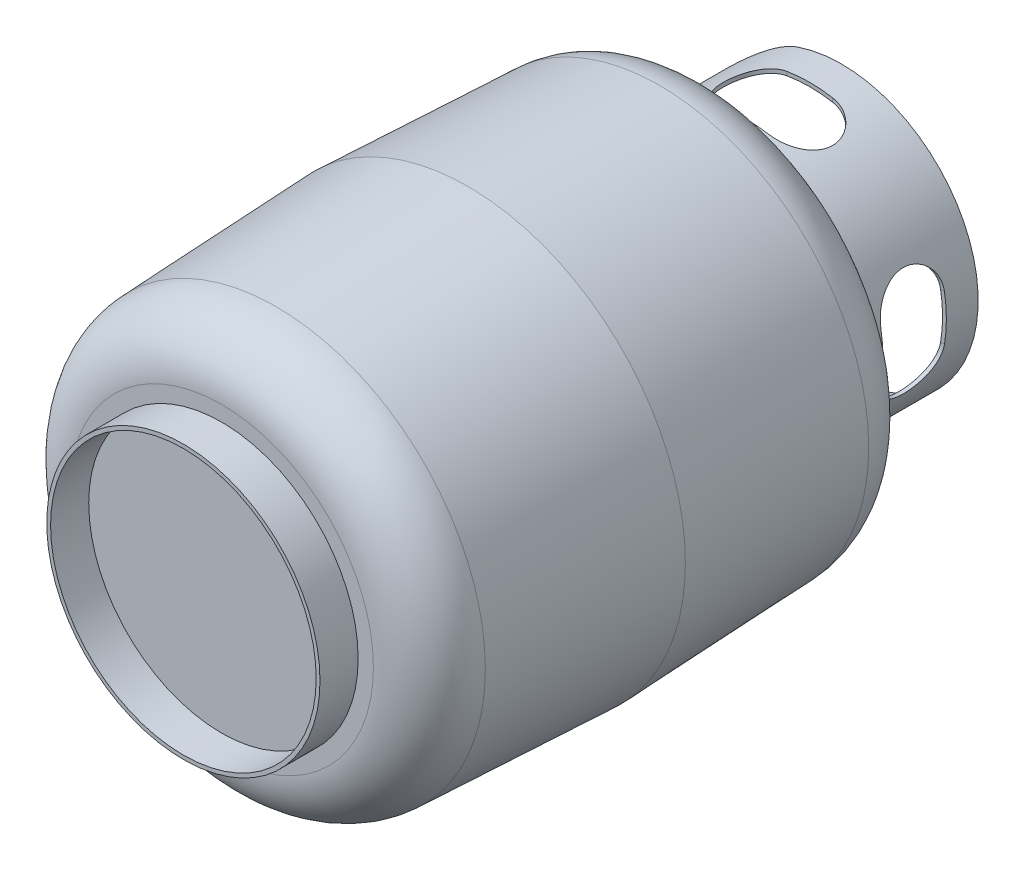
from build123d import *

# Parameters (mm, degrees)
CUT_EXTRUDE1_DEPTH      = 89
CUT_EXTRUDE1_DEPTH_BACK = 140
SKETCH2_R               = 21
SKETCH3_R               = 107.421871599
SKETCH3_R_2             = 104.421871599
BOSS_EXTRUDE1_DEPTH     = 30
BOSS_EXTRUDE2_START     = 100
BOSS_EXTRUDE2_DEPTH     = 100
FILLET3_R               = 30
CUT_EXTRUDE2_DEPTH      = 155
CUT_EXTRUDE3_DEPTH      = 310


with BuildPart() as part:
    # Sketch1 → Revolve1 (revolve)
    with BuildSketch(Plane(origin=(0, 0, 0), x_dir=(1, 0, 0), z_dir=(0, 1, 0))):
        with BuildLine():
            Line((0, 0), (119.421871599, 0))
            ThreePointArc((119.421871599, 0), (150.539959109, 12.493621707), (164.37904157, 43.037127569))
            Line((164.37904157, 43.037127569), (170.959307689, 193.75))
            Line((170.959307689, 193.75), (164.37904157, 344.462872431))
            ThreePointArc((164.37904157, 344.462872431), (150.539959109, 375.006378293), (119.421871599, 387.5))
            Line((119.421871599, 387.5), (25, 387.5))
            Line((25, 387.5), (25, 407.5))
            Line((25, 407.5), (0, 407.5))
            Line((0, 407.5), (0, 403.5))
            Line((0, 403.5), (21, 403.5))
            Line((21, 403.5), (21, 383.5))
            Line((21, 383.5), (119.421871599, 383.5))
            ThreePointArc((119.421871599, 383.5), (147.773906886, 372.116922444), (160.382848683, 344.288394882))
            Line((160.382848683, 344.288394882), (166.955496948, 193.75))
            Line((166.955496948, 193.75), (160.382848683, 43.211605118))
            ThreePointArc((160.382848683, 43.211605118), (147.773906886, 15.383077556), (119.421871599, 4))
            Line((119.421871599, 4), (0, 4))
            Line((0, 4), (0, 0))
        make_face()
    revolve(axis=Axis((0, 0, 0), (0, 0, -1)))

    # Sketch2 → Cut-Extrude1 (cut, two sides: drawn at the far end of the back side and taken through both)
    with BuildSketch(Plane(origin=(0, 0, -407.5), x_dir=(-1, 0, 0), z_dir=(0, 0, -1)).offset(-CUT_EXTRUDE1_DEPTH_BACK)):
        with Locations(Location((0, 0, 0), (0, 0, 180))):
            Circle(SKETCH2_R)
    extrude(amount=CUT_EXTRUDE1_DEPTH + CUT_EXTRUDE1_DEPTH_BACK, mode=Mode.SUBTRACT)

    # Sketch3 → Boss-Extrude1 (add)
    with BuildSketch(Plane.XY):
        Circle(SKETCH3_R)
        Circle(SKETCH3_R_2, mode=Mode.SUBTRACT)
    extrude(amount=BOSS_EXTRUDE1_DEPTH)

    # Sketch4 → Boss-Extrude2 (add)
    with BuildSketch(Plane(origin=(0, 0, -387.5), x_dir=(-1, 0, 0), z_dir=(0, 0, -1)).offset(BOSS_EXTRUDE2_START)):
        with BuildLine():
            Line((61.614654298, 87.994845721), (59.893924989, 85.537389588))
            ThreePointArc((59.893924989, 85.537389588), (-104.421871599, 0), (59.893924989, -85.537389588))
            Line((59.893924989, -85.537389588), (61.614654298, -87.994845721))
            ThreePointArc((61.614654298, -87.994845721), (-107.421871599, 0), (61.614654298, 87.994845721))
        make_face()
    extrude(amount=-BOSS_EXTRUDE2_DEPTH)

    # Fillet3
    # the kernel refuses this fillet: 30 mm, written as the material it takes off along each edge
    with BuildSketch(Plane(origin=(-104.632887024, 149.431249043, -487.5), x_dir=(0, 0, 1), z_dir=(0.5735764363510422, -0.8191520442889947, 0)), Plane(origin=(-16.875692262, -24.100986267, -487.5), x_dir=(0, 0, 1), z_dir=(-0.5735764363510615, -0.819152044288981, 0))) as fillet3_piece_1:
        with BuildLine():
            CenterArc((FILLET3_R, -FILLET3_R), FILLET3_R, 90, 90)
            Line((0, -FILLET3_R), (0, 0))
            Line((0, 0), (FILLET3_R, 0))
        make_face()
    extrude(amount=153, mode=Mode.SUBTRACT)

    # Sketch5 → Cut-Extrude2 (cut, symmetric)
    with BuildSketch(Plane(origin=(0, 0, 0), x_dir=(1, 0, 0), z_dir=(0, 1, 0))):
        with BuildLine():
            Line((18, 412.5), (-18, 412.5))
            ThreePointArc((-18, 412.5), (-43, 437.5), (-18, 462.5))
            Line((-18, 462.5), (18, 462.5))
            ThreePointArc((18, 462.5), (43, 437.5), (18, 412.5))
        make_face()
    extrude(amount=CUT_EXTRUDE2_DEPTH, both=True, mode=Mode.SUBTRACT)

    # Sketch6 → Cut-Extrude3 (cut)
    with BuildSketch(Plane(origin=(0, 0, 0), x_dir=(0, 0, -1), z_dir=(1, 0, 0))):
        with BuildLine():
            Line((462.5, 18), (462.5, -18))
            ThreePointArc((462.5, -18), (437.5, -43), (412.5, -18))
            Line((412.5, -18), (412.5, 18))
            ThreePointArc((412.5, 18), (437.5, 43), (462.5, 18))
        make_face()
    extrude(amount=CUT_EXTRUDE3_DEPTH, mode=Mode.SUBTRACT)


solid = part.part
